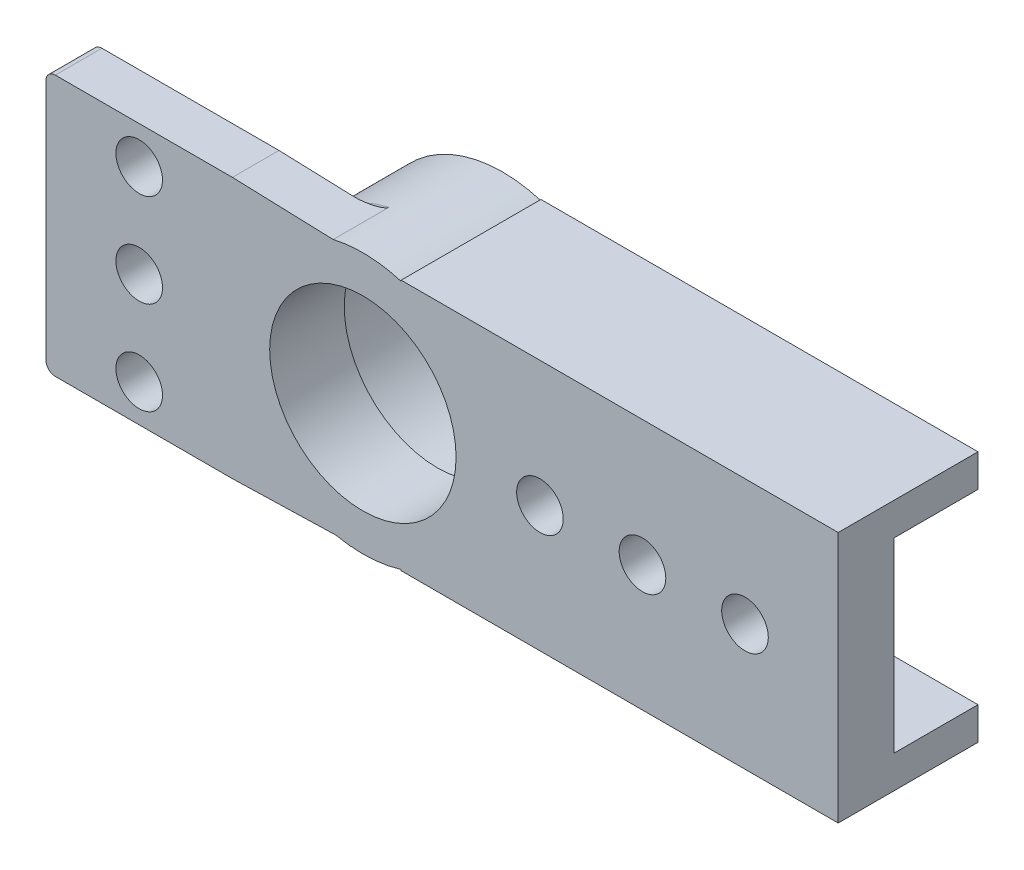
from build123d import *

# Parameters (mm, degrees)
SKETCH_1_W          = 40
SKETCH_1_H          = 20
EXTRUDE_1_DEPTH     = 6
SKETCH_2_R          = 2.5
CUT_EXTRUDE_1_DEPTH = 24.151673806
SKETCH_3_R          = 11
EXTRUDE_2_DEPTH     = 15
SKETCH_5_R          = 11
SKETCH_5_R_2        = 10
EXTRUDE_3_DEPTH     = 8
EXTRUDE_4_DEPTH     = 5
FILLET_1_R          = 1
FILLET_2_R          = 1
SKETCH_9_R          = 2.5
CUT_EXTRUDE_2_DEPTH = 5


with BuildPart() as part:
    # 草图1 → 凸台-拉伸1 (new body)
    with BuildSketch(Plane.XY):
        Rectangle(SKETCH_1_W, SKETCH_1_H)
    extrude(amount=EXTRUDE_1_DEPTH)

    # 草图2 → 切除-拉伸1 (cut, through all)
    with BuildSketch(Plane.XY.offset(6)):
        with Locations((10, 0)):
            Circle(SKETCH_2_R)
        with Locations((-1, 0)):
            Circle(SKETCH_2_R)
        with Locations((-12, 0)):
            Circle(SKETCH_2_R)
    extrude(amount=-CUT_EXTRUDE_1_DEPTH, mode=Mode.SUBTRACT)

    # 草图3 → 凸台-拉伸2 (add)
    with BuildSketch(Plane.XY.offset(6)):
        with BuildLine():
            Line((20, 10), (20, 13.5))
            Line((20, 13.5), (-26.893967141, 13.5))
            Line((-26.893967141, 13.5), (-26.893967141, 13.384337644))
            ThreePointArc((-26.893967141, 13.384337644), (-45, 0), (-26.893967141, -13.384337644))
            Line((-26.893967141, -13.384337644), (-26.893967141, -13.5))
            Line((-26.893967141, -13.5), (20, -13.5))
            Line((20, -13.5), (20, -10))
            Line((20, -10), (-20, -10))
            Line((-20, -10), (-20, -8.660254038))
            ThreePointArc((-20, -8.660254038), (-17, 0), (-20, 8.660254038))
            Line((-20, 8.660254038), (-20, 10))
            Line((-20, 10), (20, 10))
        make_face()
        with Locations((-31, 0)):
            Circle(SKETCH_3_R, mode=Mode.SUBTRACT)
    extrude(amount=-EXTRUDE_2_DEPTH)

    # 草图5 → 凸台-拉伸3 (add)
    with BuildSketch(Plane.XY.offset(6)):
        with Locations((-31, 0)):
            Circle(SKETCH_5_R)
        with Locations((-31, 0)):
            Circle(SKETCH_5_R_2, mode=Mode.SUBTRACT)
    extrude(amount=-EXTRUDE_3_DEPTH)

    # 草图8 → 凸台-拉伸4 (add)
    with BuildSketch(Plane.XY.offset(6)):
        with BuildLine():
            ThreePointArc((-33.911999365, -13.693803697), (-44.999289152, -0.141078849), (-34.187380521, 13.632336755))
            Line((-34.187380521, 13.632336755), (-45, 14))
            Line((-45, 14), (-65, 14))
            Line((-65, 14), (-65, -14))
            Line((-65, -14), (-45, -14))
            Line((-45, -14), (-33.911999365, -13.693803697))
        make_face()
    extrude(amount=-EXTRUDE_4_DEPTH)

    # 圆角1
    fillet_1_edges = [part.edges().sort_by_distance(p)[0] for p in [
        (-44.999289152, -0.141078849, 1),
    ]]
    fillet(fillet_1_edges, radius=FILLET_1_R)

    # 圆角2
    fillet_2_edges = [part.edges().sort_by_distance(p)[0] for p in [
        (-65, 14, 3.5),
        (-65, -14, 3.5),
    ]]
    fillet(fillet_2_edges, radius=FILLET_2_R)

    # 草图9 → 切除-拉伸2 (cut)
    with BuildSketch(Plane.XY.offset(6)):
        with Locations((-55, 0)):
            Circle(SKETCH_9_R)
        with Locations((-55, 10)):
            Circle(SKETCH_9_R)
        with Locations((-55, -10)):
            Circle(SKETCH_9_R)
    extrude(amount=-CUT_EXTRUDE_2_DEPTH, mode=Mode.SUBTRACT)


solid = part.part
